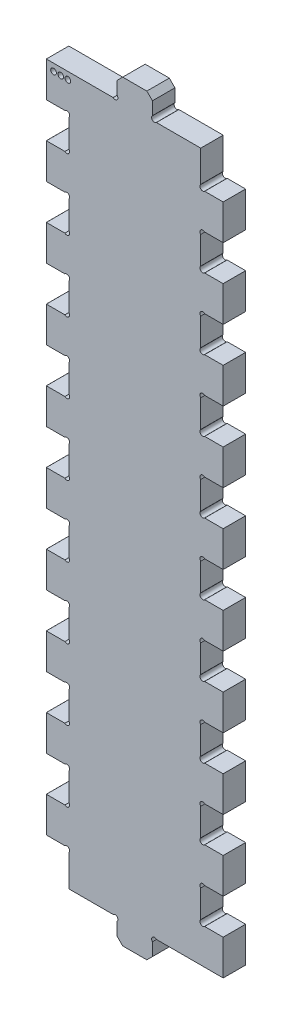
from build123d import *

# Parameters (mm, degrees)
SKETCH1_W           = 50.000000076
SKETCH1_H           = 200.000108
BOSS_EXTRUDE1_DEPTH = 6.35
SKETCH2_W           = 10.0000054
SKETCH2_H           = 6.35
BOSS_EXTRUDE2_DEPTH = 6.35
SKETCH8_W           = 6.35
SKETCH8_H           = 10.0000054
CUT_EXTRUDE6_DEPTH  = 213.416311942
LPATTERN4_COUNT     = 10
LPATTERN4_PITCH     = 20.0000108
SKETCH9_R           = 0.79375
CUT_EXTRUDE7_DEPTH  = 213.416311942
LPATTERN5_COUNT     = 9
LPATTERN5_PITCH     = 20.0000108
SKETCH10_R          = 0.79375
CUT_EXTRUDE8_DEPTH  = 213.416311942
CHAMFER1_SIZE       = 1.5875
SKETCH11_R          = 0.79375
CUT_EXTRUDE10_DEPTH = 213.416311942
SKETCH14_W          = 6.3240118
SKETCH14_H          = 10.0254054
CUT_EXTRUDE13_DEPTH = 213.416311942
LPATTERN7_COUNT     = 10
LPATTERN7_PITCH     = 20.0000108
SKETCH15_R          = 0.79375
CUT_EXTRUDE14_DEPTH = 3.175
LPATTERN8_COUNT     = 3
LPATTERN8_PITCH     = 2.032


with BuildPart() as part:
    # Sketch1 → Boss-Extrude1 (new body)
    with BuildSketch(Plane.XY):
        with Locations((25.000000038, 100.000054)):
            Rectangle(SKETCH1_W, SKETCH1_H)
    extrude(amount=BOSS_EXTRUDE1_DEPTH)

    # Sketch2 → Boss-Extrude2 (add)
    with BuildSketch(Plane.XY):
        with Locations((25.000000038, 203.175108)):
            Rectangle(SKETCH2_W, SKETCH2_H)
        with Locations((25.000000038, -3.175)):
            Rectangle(SKETCH2_W, SKETCH2_H)
    extrude(amount=BOSS_EXTRUDE2_DEPTH)

    # Sketch8 → Cut-Extrude6 (cut, through all)
    with BuildSketch(Plane.XY.offset(6.35)):
        with Locations((3.175, 5.0000027)):
            Rectangle(SKETCH8_W, SKETCH8_H)
        with Locations((46.825000076, 15.0000081)):
            Rectangle(SKETCH8_W, SKETCH8_H)
    cut_extrude6 = extrude(amount=-CUT_EXTRUDE6_DEPTH, mode=Mode.SUBTRACT)

    # LPattern4: Cut-Extrude6 ×10
    with Locations(*[(0, i * LPATTERN4_PITCH, 0) for i in range(1, LPATTERN4_COUNT)]):
        add(cut_extrude6, mode=Mode.SUBTRACT)

    # Sketch9 → Cut-Extrude7 (cut, through all)
    with BuildSketch(Plane.XY.offset(6.35)):
        with Locations((5.788733992, 29.438750192)):
            Circle(SKETCH9_R)
        with Locations((5.788733992, 20.561276808)):
            Circle(SKETCH9_R)
        with Locations((44.211266084, 19.438744792)):
            Circle(SKETCH9_R)
        with Locations((44.211266084, 10.561271408)):
            Circle(SKETCH9_R)
    cut_extrude7 = extrude(amount=-CUT_EXTRUDE7_DEPTH, mode=Mode.SUBTRACT)

    # LPattern5: Cut-Extrude7 ×9
    with Locations(*[(0, i * LPATTERN5_PITCH, 0) for i in range(1, LPATTERN5_COUNT)]):
        add(cut_extrude7, mode=Mode.SUBTRACT)

    # Sketch10 → Cut-Extrude8 (cut, through all)
    with BuildSketch(Plane.XY.offset(6.35)):
        with Locations((5.788733992, 9.438739392)):
            Circle(SKETCH10_R)
        with Locations((44.211266084, 190.561368608)):
            Circle(SKETCH10_R)
    extrude(amount=-CUT_EXTRUDE8_DEPTH, mode=Mode.SUBTRACT)

    # Chamfer1
    chamfer1_edges = [part.edges().sort_by_distance(p)[0] for p in [
        (30.000002738, -6.35, 3.175),
        (19.999997338, -6.35, 3.175),
        (19.999997338, 206.350108, 3.175),
        (30.000002738, 206.350108, 3.175),
    ]]
    chamfer(chamfer1_edges, length=CHAMFER1_SIZE)

    # Sketch11 → Cut-Extrude10 (cut, through all)
    with BuildSketch(Plane.XY):
        with Locations((19.43873133, 200.561374008)):
            Circle(SKETCH11_R)
        with Locations((30.561268746, 200.561374008)):
            Circle(SKETCH11_R)
        with Locations((19.43873133, -0.561266008)):
            Circle(SKETCH11_R)
        with Locations((30.561268746, -0.561266008)):
            Circle(SKETCH11_R)
    extrude(amount=CUT_EXTRUDE10_DEPTH, mode=Mode.SUBTRACT)

    # Sketch14 → Cut-Extrude13 (cut, through all)
    with BuildSketch(Plane.XY.offset(6.35)):
        with Locations((3.175, 5.0000027)):
            Rectangle(SKETCH14_W, SKETCH14_H)
        with Locations((46.825000076, 15.0000081)):
            Rectangle(SKETCH14_W, SKETCH14_H)
    cut_extrude13 = extrude(amount=-CUT_EXTRUDE13_DEPTH, mode=Mode.SUBTRACT)

    # LPattern7: Cut-Extrude13 ×10
    with Locations(*[(0, i * LPATTERN7_PITCH, 0) for i in range(1, LPATTERN7_COUNT)]):
        add(cut_extrude13, mode=Mode.SUBTRACT)

    # Sketch15 → Cut-Extrude14 (cut)
    with BuildSketch(Plane.XY.offset(6.35)):
        with Locations((2.032, 197.968108)):
            Circle(SKETCH15_R)
    cut_extrude14 = extrude(amount=-CUT_EXTRUDE14_DEPTH, mode=Mode.SUBTRACT)

    # LPattern8: Cut-Extrude14 ×3
    with Locations(*[(i * LPATTERN8_PITCH, 0, 0) for i in range(1, LPATTERN8_COUNT)]):
        add(cut_extrude14, mode=Mode.SUBTRACT)


solid = part.part
